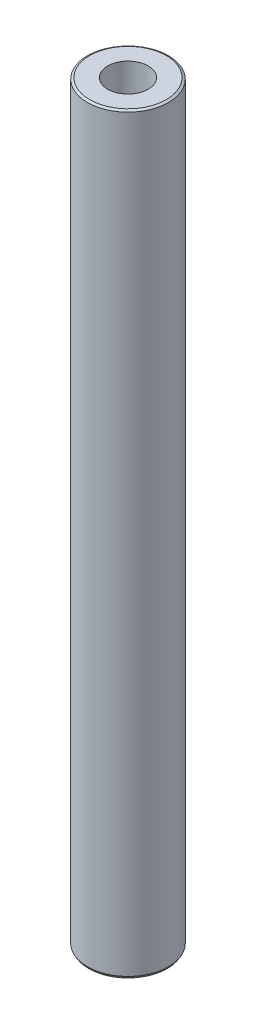
from build123d import *
from OCP.BRepFilletAPI import BRepFilletAPI_MakeChamfer

# Parameters (mm, degrees)
SKETCH1_R           = 12.5
BOSS_EXTRUDE1_DEPTH = 231.940165823
SKETCH2_R           = 6.238693781
CUT_EXTRUDE1_DEPTH  = 233.612855453
CHAMFER1_SIZE       = 0.405774004
CHAMFER1_SIZE2      = 0.702821192


with BuildPart() as part:
    # Sketch1 → Boss-Extrude1 (new body)
    with BuildSketch(Plane(origin=(0, 0, 0), x_dir=(1, 0, 0), z_dir=(0, 1, 0))):
        Circle(SKETCH1_R)
    extrude(amount=BOSS_EXTRUDE1_DEPTH)

    # Sketch2 → Cut-Extrude1 (cut, through all)
    with BuildSketch(Plane(origin=(0, 0, 0), x_dir=(1, 0, 0), z_dir=(0, 1, 0))):
        Circle(SKETCH2_R)
    extrude(amount=CUT_EXTRUDE1_DEPTH, mode=Mode.SUBTRACT)

    # Chamfer1: one chamfer whose edges measure the first distance from different faces: ONE call of the kernel's chamfer builder (chamfer() names one face for all edges)
    chamfer1_edges_1 = [part.edges().sort_by_distance(p)[0] for p in [
        (-12.5, 231.940165823, 0),
    ]]
    chamfer1_side_1 = [part.faces().sort_by_distance(p)[0] for p in [
        (-12.5, 115.970082912, 0),
    ]]
    chamfer1_edges_2 = [part.edges().sort_by_distance(p)[0] for p in [
        (-12.5, 0, 0),
    ]]
    chamfer1_side_2 = [part.faces().sort_by_distance(p)[0] for p in [
        (-12.146446609, 0, 0),
    ]]
    chamfer1 = BRepFilletAPI_MakeChamfer(part.part.solid().wrapped)
    for e in chamfer1_edges_1:
        chamfer1.Add(CHAMFER1_SIZE, CHAMFER1_SIZE2, e.wrapped, chamfer1_side_1[0].wrapped)  # the first distance lies on this face
    for e in chamfer1_edges_2:
        chamfer1.Add(CHAMFER1_SIZE, CHAMFER1_SIZE2, e.wrapped, chamfer1_side_2[0].wrapped)  # the first distance lies on this face
    add(Compound.cast(chamfer1.Shape()), mode=Mode.REPLACE)


solid = part.part
